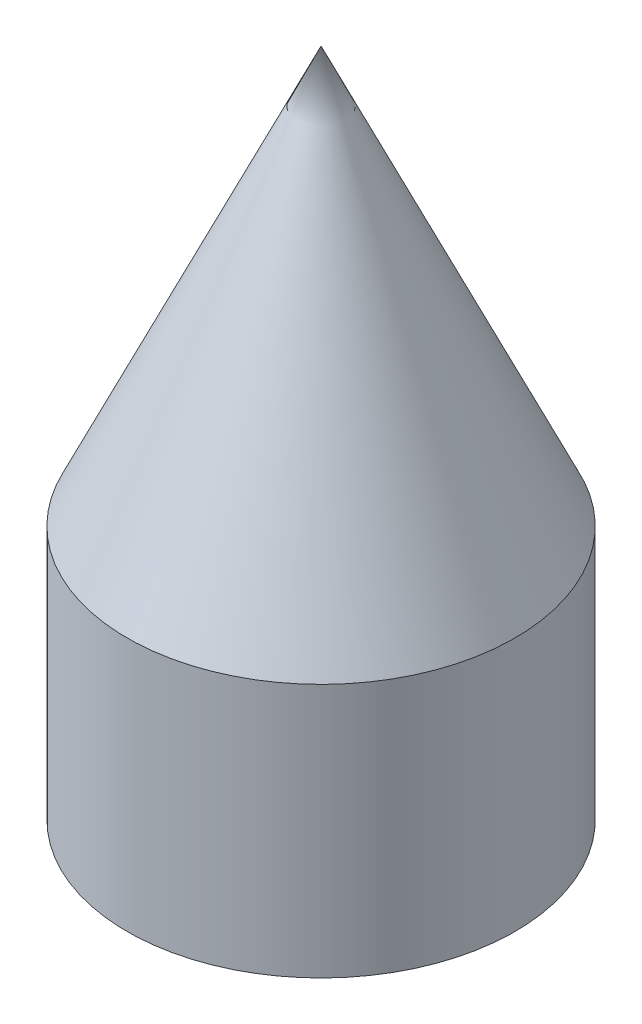
from build123d import *


with BuildPart() as part:
    # Esquisse1 → Révolution1 (revolve)
    with BuildSketch(Plane.XY):
        Polygon((3.1, 0), (3.1, 6), (0, 6), (0, 21.081492215), (6.1, 8), (6.1, 0), align=None)
    revolve(axis=Axis((0, 0, 0), (0, 1, 0)))


solid = part.part
